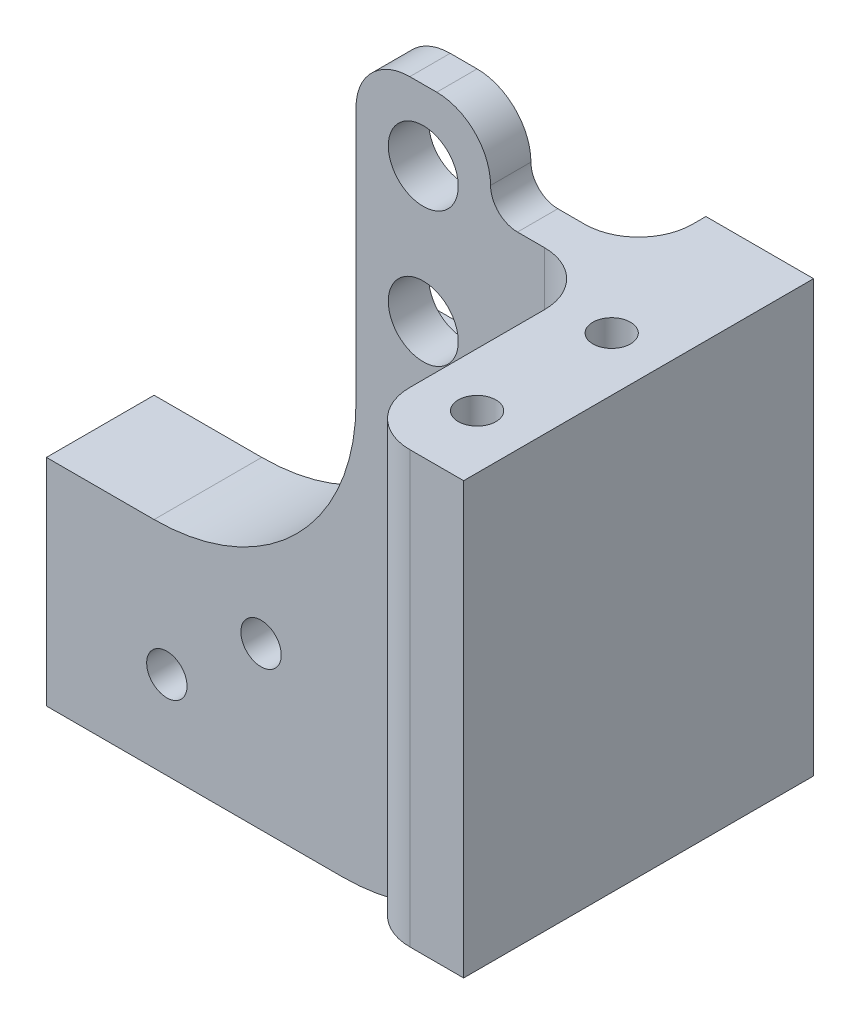
from build123d import *
from OCP.BRepFilletAPI import BRepFilletAPI_MakeFillet

# Parameters (mm, degrees)
SKETCH1_R           = 2.6
BOSS_EXTRUDE1_DEPTH = 26
SKETCH2_W           = 18
SKETCH2_H           = 20
CUT_EXTRUDE1_DEPTH  = 5
CUT_EXTRUDE2_START  = 26
SKETCH3_W           = 18
SKETCH3_H           = 38
CUT_EXTRUDE2_DEPTH  = 18
CUT_EXTRUDE3_START  = 18.5
SKETCH4_R           = 1.4
CUT_EXTRUDE3_DEPTH  = 10
FILLET1_R           = 4
FILLET1_R_2         = 2
CUT_EXTRUDE4_DEPTH  = 2
SKETCH6_W           = 37
SKETCH6_H           = 16
BOSS_EXTRUDE2_DEPTH = 8
FILLET2_R           = 15
SKETCH7_R           = 1.5
CUT_EXTRUDE5_DEPTH  = 22


with BuildPart() as part:
    # Sketch1 → Boss-Extrude1 (new body)
    with BuildSketch(Plane.XY):
        Polygon((-13, -13.5), (13, -13.5), (13, 18.5), (-3, 18.5), (-3, 24.5), (-13, 24.5), (-13, 13.5), align=None)
        with Locations(Location((-8, 19.25, 0), (0, 0, 180))):
            Circle(SKETCH1_R, mode=Mode.SUBTRACT)
        with Locations(Location((-8, 9.25, 0), (0, 0, 180))):
            Circle(SKETCH1_R, mode=Mode.SUBTRACT)
    extrude(amount=BOSS_EXTRUDE1_DEPTH)

    # Sketch2 → Cut-Extrude1 (cut)
    with BuildSketch(Plane.XY):
        with Locations((-4, 14.5)):
            Rectangle(SKETCH2_W, SKETCH2_H)
    extrude(amount=CUT_EXTRUDE1_DEPTH, mode=Mode.SUBTRACT)

    # Sketch3 → Cut-Extrude2 (cut)
    with BuildSketch(Plane.XY.offset(CUT_EXTRUDE2_START)):
        with Locations((-4, 5.5)):
            Rectangle(SKETCH3_W, SKETCH3_H)
    extrude(amount=-CUT_EXTRUDE2_DEPTH, mode=Mode.SUBTRACT)

    # Sketch4 → Cut-Extrude3 (cut)
    with BuildSketch(Plane(origin=(0, 0, 0), x_dir=(1, 0, 0), z_dir=(0, 1, 0)).offset(CUT_EXTRUDE3_START)):
        with Locations(Location((9, -11, 0), (0, 0, 270))):
            Circle(SKETCH4_R)
        with Locations(Location((9, -21, 0), (0, 0, 270))):
            Circle(SKETCH4_R)
    extrude(amount=-CUT_EXTRUDE3_DEPTH, mode=Mode.SUBTRACT)

    # Fillet1
    fillet1_edges_1 = [part.edges().sort_by_distance(p)[0] for p in [
        (-3, 24.5, 6.5),
        (-13, 24.5, 6.5),
        (5, 11.5, 5),
        (5, 2.5, 8),
        (5, 2.5, 26),
    ]]
    fillet1_edges_2 = [part.edges().sort_by_distance(p)[0] for p in [
        (-3, 18.5, 6.5),
    ]]
    fillet1 = BRepFilletAPI_MakeFillet(part.part.solid().wrapped)
    for e in fillet1_edges_1:
        fillet1.Add(FILLET1_R - 0.0001, e.wrapped)
    for e in fillet1_edges_2:
        fillet1.Add(FILLET1_R_2 - 0.0001, e.wrapped)
    add(Compound.cast(fillet1.Shape()), mode=Mode.REPLACE)  # a hair under: the kernel refuses the full size

    # Sketch5 → Cut-Extrude4 (cut)
    with BuildSketch(Plane.XY):
        with BuildLine():
            Line((-8, -5.85), (-13, -5.85))
            Line((-13, -5.85), (-13, 4.5))
            Line((-13, 4.5), (-8, 4.5))
            Line((-8, 4.5), (-2.9, 4.5))
            Line((-2.9, 4.5), (-2.9, -0.75))
            ThreePointArc((-2.9, -0.75), (-4.393755416, -4.356244584), (-8, -5.85))
        make_face()
    extrude(amount=CUT_EXTRUDE4_DEPTH, mode=Mode.SUBTRACT)

    # Sketch6 → Boss-Extrude2 (add)
    with BuildSketch(Plane.XY):
        with Locations((-17.5, -21.5)):
            Rectangle(SKETCH6_W, SKETCH6_H)
    extrude(amount=BOSS_EXTRUDE2_DEPTH)

    # Fillet2
    fillet2_edges = [part.edges().sort_by_distance(p)[0] for p in [
        (-13, -13.5, 4),
        (1, -29.5, 4),
    ]]
    fillet(fillet2_edges, radius=FILLET2_R)

    # Sketch7 → Cut-Extrude5 (cut)
    with BuildSketch(Plane.XY):
        with Locations(Location((-20.052596491, -17.5, 0), (0, 0, 180))):
            Circle(SKETCH7_R)
        with Locations(Location((-27.052596491, -23, 0), (0, 0, 180))):
            Circle(SKETCH7_R)
    extrude(amount=CUT_EXTRUDE5_DEPTH, mode=Mode.SUBTRACT)


solid = part.part
